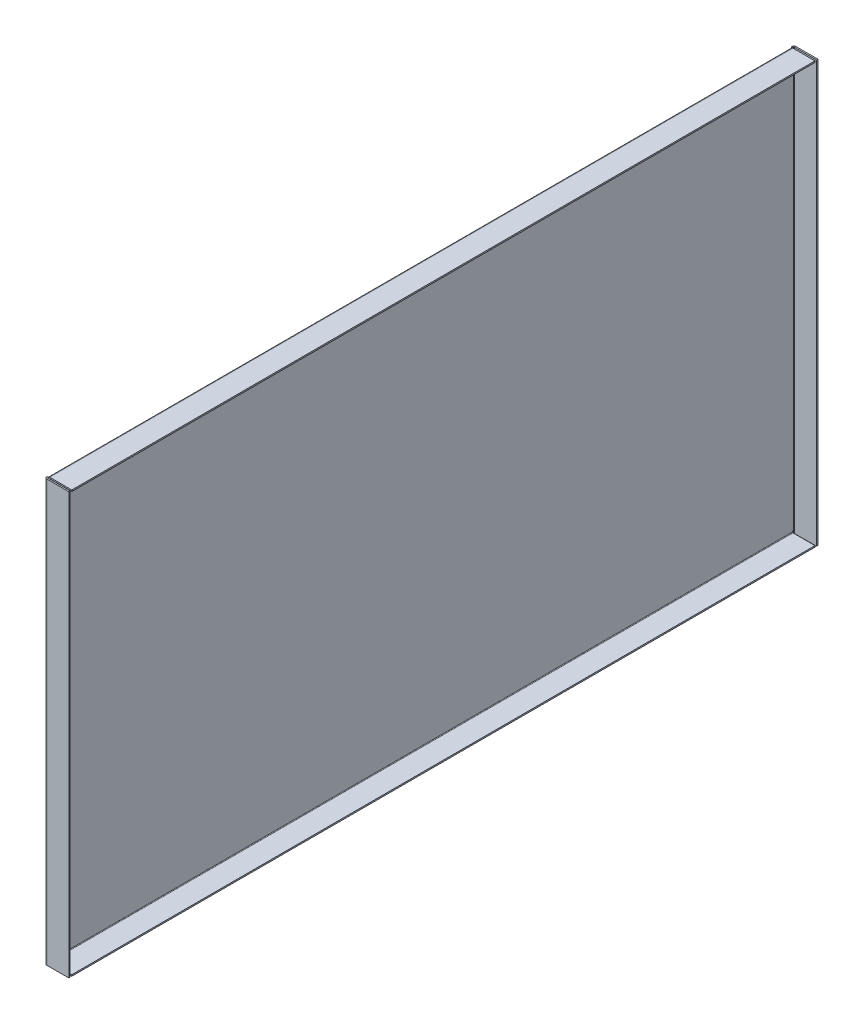
from build123d import *

# Parameters (mm, degrees)
SKETCH1_W                     = 935.7
SKETCH1_H                     = 528
BASE_FLANGE1_DEPTH            = 1.7366
EDGE_FLANGE1_STRIP_W          = 8.4196
EDGE_FLANGE1_STRIP_H          = 1.7366
EDGE_FLANGE1_STRIP_CUT_DEPTH  = 931.7
EDGE_FLANGE1_RELIEF_W         = 9.2879
EDGE_FLANGE1_RELIEF_H         = 0.8683
EDGE_FLANGE1_RELIEF_CUT_DEPTH = 1.7366
EDGE_FLANGE1_DEPTH            = 931.7
EDGE_FLANGE2_STRIP_W          = 8.4196
EDGE_FLANGE2_STRIP_H          = 1.7366
EDGE_FLANGE2_STRIP_CUT_DEPTH  = 931.7
EDGE_FLANGE2_RELIEF_W         = 9.2879
EDGE_FLANGE2_RELIEF_H         = 0.8683
EDGE_FLANGE2_RELIEF_CUT_DEPTH = 1.7366
EDGE_FLANGE2_DEPTH            = 931.7
EDGE_FLANGE4_STRIP_W          = 8.4196
EDGE_FLANGE4_STRIP_H          = 1.7366
EDGE_FLANGE4_STRIP_CUT_DEPTH  = 528
EDGE_FLANGE4_DEPTH            = 528
EDGE_FLANGE5_STRIP_W          = 8.4196
EDGE_FLANGE5_STRIP_H          = 1.7366
EDGE_FLANGE5_STRIP_CUT_DEPTH  = 528
EDGE_FLANGE5_DEPTH            = 528


# Sheet-metal steps are written as plain solids
with BuildPart() as part:
    # Sketch1 → Base-Flange1 (new body)
    with BuildSketch(Plane(origin=(0, 0, 0), x_dir=(0, 0, -1), z_dir=(1, 0, 0))):
        Rectangle(SKETCH1_W, SKETCH1_H)
    extrude(amount=-BASE_FLANGE1_DEPTH)

    # Edge-Flange1 strip (across the edge) → Edge-Flange1 strip cut (cut)
    with BuildSketch(Plane(origin=(0, 264, -465.85), x_dir=(0, -1, 0), z_dir=(0, 0, 1))):
        with Locations((-1.7366, -0.8683)):
            Rectangle(EDGE_FLANGE1_STRIP_W, EDGE_FLANGE1_STRIP_H)
    extrude(amount=EDGE_FLANGE1_STRIP_CUT_DEPTH, mode=Mode.SUBTRACT)

    # Edge-Flange1 relief (on the sheet) → Edge-Flange1 relief cut (cut)
    with BuildSketch(Plane(origin=(0, 261.5268, -465.85), x_dir=(0, -1, 0), z_dir=(1, 0, 0))):
        with Locations((-3.77565, 0.43415)):
            Rectangle(EDGE_FLANGE1_RELIEF_W, EDGE_FLANGE1_RELIEF_H)
        with Locations((-3.77565, -932.13415)):
            Rectangle(EDGE_FLANGE1_RELIEF_W, EDGE_FLANGE1_RELIEF_H)
    extrude(amount=-EDGE_FLANGE1_RELIEF_CUT_DEPTH, mode=Mode.SUBTRACT)

    # Edge-Flange1 section (across the edge) → Edge-Flange1 (add)
    with BuildSketch(Plane(origin=(0, 264, -465.85), x_dir=(0, -1, 0), z_dir=(0, 0, 1))):
        with BuildLine():
            Line((0, 0.7366), (0, 28.2634))
            Line((0, 28.2634), (1.7366, 28.2634))
            Line((1.7366, 28.2634), (1.7366, 0.7366))
            ThreePointArc((1.7366, 0.7366), (1.952345145, 0.215745145), (2.4732, 0))
            Line((2.4732, 0), (2.4732, -1.7366))
            ThreePointArc((2.4732, -1.7366), (0.724383509, -1.012216491), (0, 0.7366))
        make_face()
    extrude(amount=EDGE_FLANGE1_DEPTH)

    # Edge-Flange2 strip (across the edge) → Edge-Flange2 strip cut (cut)
    with BuildSketch(Plane(origin=(0, -264, 465.85), x_dir=(0, 1, 0), z_dir=(0, 0, -1))):
        with Locations((-1.7366, -0.8683)):
            Rectangle(EDGE_FLANGE2_STRIP_W, EDGE_FLANGE2_STRIP_H)
    extrude(amount=EDGE_FLANGE2_STRIP_CUT_DEPTH, mode=Mode.SUBTRACT)

    # Edge-Flange2 relief (on the sheet) → Edge-Flange2 relief cut (cut)
    with BuildSketch(Plane(origin=(0, -261.5268, 465.85), x_dir=(0, 1, 0), z_dir=(1, 0, 0))):
        with Locations((-3.77565, 0.43415)):
            Rectangle(EDGE_FLANGE2_RELIEF_W, EDGE_FLANGE2_RELIEF_H)
        with Locations((-3.77565, -932.13415)):
            Rectangle(EDGE_FLANGE2_RELIEF_W, EDGE_FLANGE2_RELIEF_H)
    extrude(amount=-EDGE_FLANGE2_RELIEF_CUT_DEPTH, mode=Mode.SUBTRACT)

    # Edge-Flange2 section (across the edge) → Edge-Flange2 (add)
    with BuildSketch(Plane(origin=(0, -264, 465.85), x_dir=(0, 1, 0), z_dir=(0, 0, -1))):
        with BuildLine():
            Line((0, 0.7366), (0, 28.2634))
            Line((0, 28.2634), (1.7366, 28.2634))
            Line((1.7366, 28.2634), (1.7366, 0.7366))
            ThreePointArc((1.7366, 0.7366), (1.952345145, 0.215745145), (2.4732, 0))
            Line((2.4732, 0), (2.4732, -1.7366))
            ThreePointArc((2.4732, -1.7366), (0.724383509, -1.012216491), (0, 0.7366))
        make_face()
    extrude(amount=EDGE_FLANGE2_DEPTH)

    # Edge-Flange4 strip (across the edge) → Edge-Flange4 strip cut (cut)
    with BuildSketch(Plane(origin=(0, 264, 467.85), x_dir=(0, 0, -1), z_dir=(0, -1, 0))):
        with Locations((-3.4732, -0.8683)):
            Rectangle(EDGE_FLANGE4_STRIP_W, EDGE_FLANGE4_STRIP_H)
    extrude(amount=EDGE_FLANGE4_STRIP_CUT_DEPTH, mode=Mode.SUBTRACT)

    # Edge-Flange4 section (across the edge) → Edge-Flange4 (add)
    with BuildSketch(Plane(origin=(0, 264, 467.85), x_dir=(0, 0, -1), z_dir=(0, -1, 0))):
        with BuildLine():
            Line((-1.7366, 0.7366), (-1.7366, 28.2634))
            Line((-1.7366, 28.2634), (0, 28.2634))
            Line((0, 28.2634), (0, 0.7366))
            ThreePointArc((0, 0.7366), (0.215745145, 0.215745145), (0.7366, 0))
            Line((0.7366, 0), (0.7366, -1.7366))
            ThreePointArc((0.7366, -1.7366), (-1.012216491, -1.012216491), (-1.7366, 0.7366))
        make_face()
    extrude(amount=EDGE_FLANGE4_DEPTH)

    # Edge-Flange5 strip (across the edge) → Edge-Flange5 strip cut (cut)
    with BuildSketch(Plane(origin=(0, -264, -467.85), x_dir=(0, 0, 1), z_dir=(0, 1, 0))):
        with Locations((-3.4732, -0.8683)):
            Rectangle(EDGE_FLANGE5_STRIP_W, EDGE_FLANGE5_STRIP_H)
    extrude(amount=EDGE_FLANGE5_STRIP_CUT_DEPTH, mode=Mode.SUBTRACT)

    # Edge-Flange5 section (across the edge) → Edge-Flange5 (add)
    with BuildSketch(Plane(origin=(0, -264, -467.85), x_dir=(0, 0, 1), z_dir=(0, 1, 0))):
        with BuildLine():
            Line((-1.7366, 0.7366), (-1.7366, 28.2634))
            Line((-1.7366, 28.2634), (0, 28.2634))
            Line((0, 28.2634), (0, 0.7366))
            ThreePointArc((0, 0.7366), (0.215745145, 0.215745145), (0.7366, 0))
            Line((0.7366, 0), (0.7366, -1.7366))
            ThreePointArc((0.7366, -1.7366), (-1.012216491, -1.012216491), (-1.7366, 0.7366))
        make_face()
    extrude(amount=EDGE_FLANGE5_DEPTH)


solid = part.part
